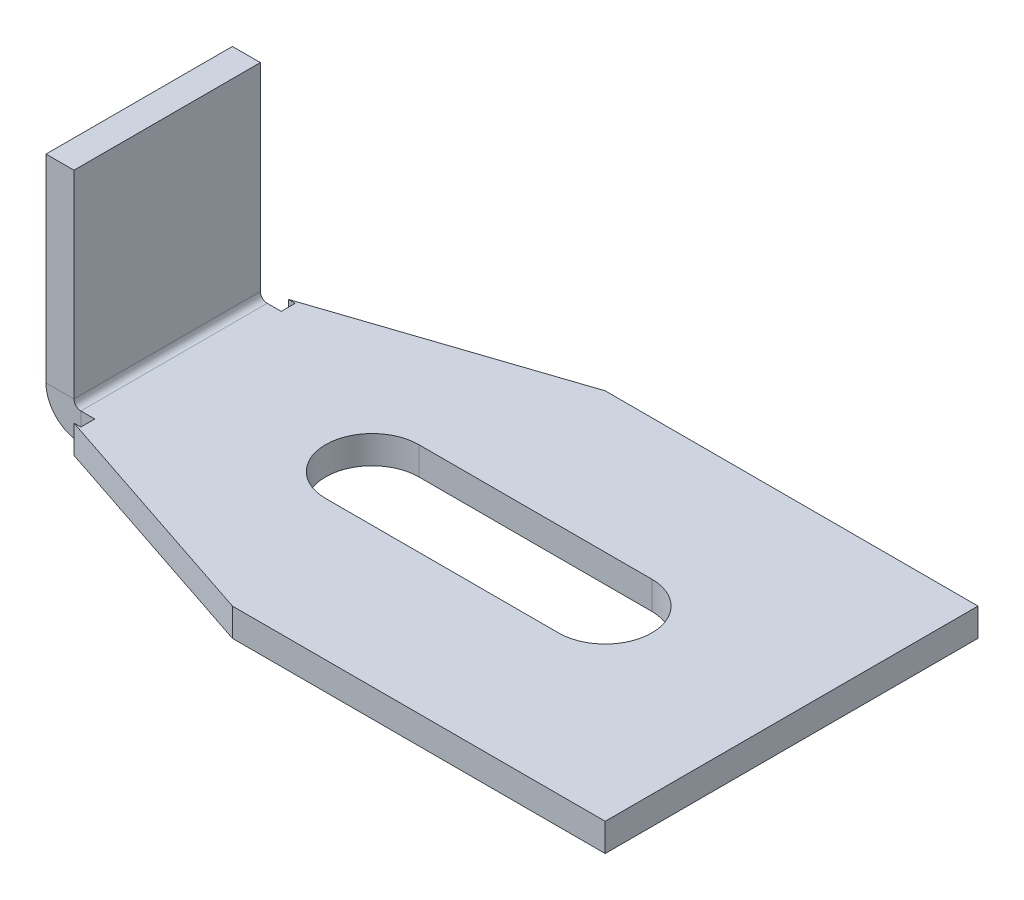
from build123d import *

# Parameters (mm, degrees)
BASE_FLANGE1_DEPTH            = 3
EDGE_FLANGE1_STRIP_W          = 13.4732
EDGE_FLANGE1_STRIP_H          = 3
EDGE_FLANGE1_STRIP_CUT_DEPTH  = 20
EDGE_FLANGE1_RELIEF_W         = 14.9732
EDGE_FLANGE1_RELIEF_H         = 1.5
EDGE_FLANGE1_RELIEF_CUT_DEPTH = 3
EDGE_FLANGE1_DEPTH            = 20
CUT_EXTRUDE1_DEPTH            = 10


# Sheet-metal steps are written as plain solids
with BuildPart() as part:
    # Sketch1 → Base-Flange1 (new body)
    with BuildSketch(Plane(origin=(0, 0, 0), x_dir=(1, 0, 0), z_dir=(0, 1, 0))):
        Polygon((0, 0), (0, 10), (30, 20), (70, 20), (70, 0), (70, -20), (30, -20), (0, -10), align=None)
    extrude(amount=-BASE_FLANGE1_DEPTH)

    # Edge-Flange1 strip (across the edge) → Edge-Flange1 strip cut (cut)
    with BuildSketch(Plane.XY.offset(-10)):
        with Locations((-3, -1.5)):
            Rectangle(EDGE_FLANGE1_STRIP_W, EDGE_FLANGE1_STRIP_H)
    extrude(amount=EDGE_FLANGE1_STRIP_CUT_DEPTH, mode=Mode.SUBTRACT)

    # Edge-Flange1 relief (on the sheet) → Edge-Flange1 relief cut (cut)
    with BuildSketch(Plane(origin=(3.7366, 0, -10), x_dir=(1, 0, 0), z_dir=(0, 1, 0))):
        with Locations((-5.9866, 0.75)):
            Rectangle(EDGE_FLANGE1_RELIEF_W, EDGE_FLANGE1_RELIEF_H)
        with Locations((-5.9866, -20.75)):
            Rectangle(EDGE_FLANGE1_RELIEF_W, EDGE_FLANGE1_RELIEF_H)
    extrude(amount=-EDGE_FLANGE1_RELIEF_CUT_DEPTH, mode=Mode.SUBTRACT)

    # Edge-Flange1 section (across the edge) → Edge-Flange1 (add)
    with BuildSketch(Plane.XY.offset(-10)):
        with BuildLine():
            Line((0, 0.7366), (0, 22))
            Line((0, 22), (3, 22))
            Line((3, 22), (3, 0.7366))
            ThreePointArc((3, 0.7366), (3.215745145, 0.215745145), (3.7366, 0))
            Line((3.7366, 0), (3.7366, -3))
            ThreePointArc((3.7366, -3), (1.094424801, -1.905575199), (0, 0.7366))
        make_face()
    extrude(amount=EDGE_FLANGE1_DEPTH)

    # Sketch9 → Cut-Extrude1 (cut)
    with BuildSketch(Plane(origin=(0, 0, 0), x_dir=(1, 0, 0), z_dir=(0, 1, 0))):
        with BuildLine():
            Line((50, -5), (25, -5))
            ThreePointArc((25, -5), (20, 0), (25, 5))
            Line((25, 5), (50, 5))
            ThreePointArc((50, 5), (55, 0), (50, -5))
        make_face()
    extrude(amount=-CUT_EXTRUDE1_DEPTH, mode=Mode.SUBTRACT)


solid = part.part
